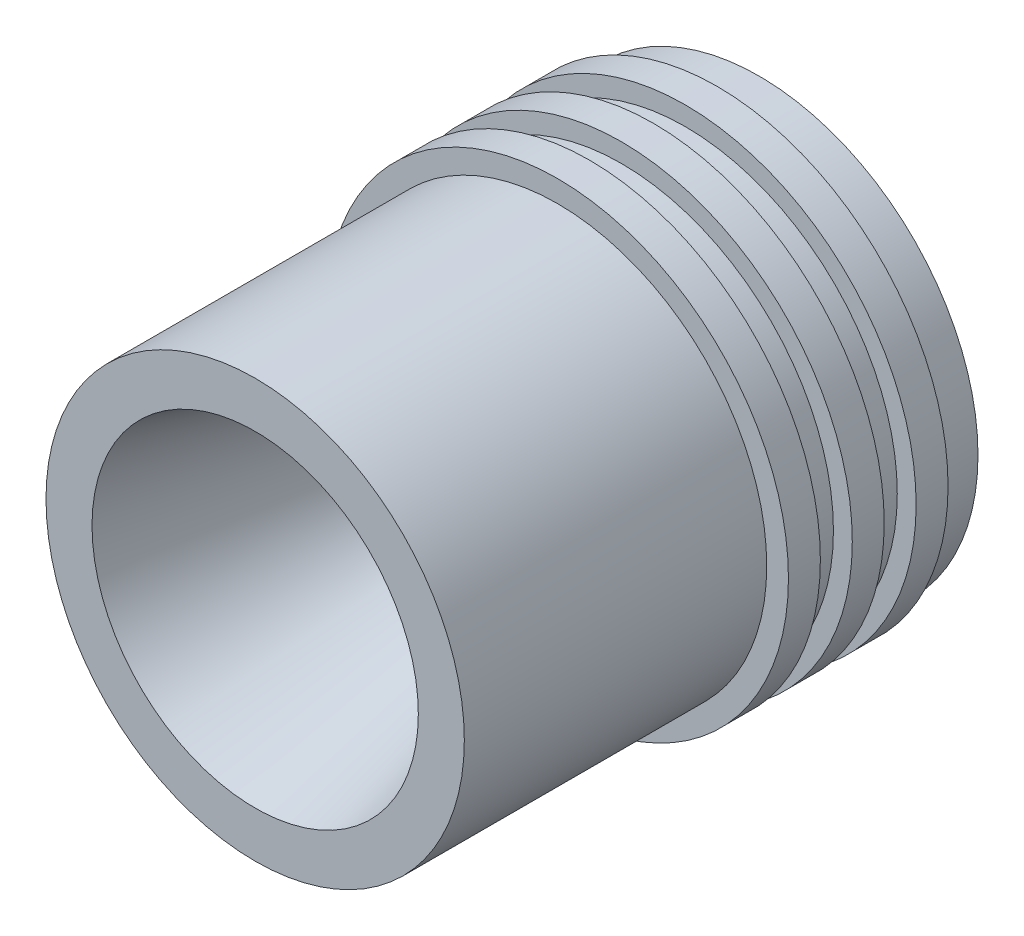
from build123d import *

# Parameters (mm, degrees)
SKETCH2_W = 6.35
SKETCH2_H = 9.652


with BuildPart() as part:
    # Sketch1 → Revolve1 (revolve)
    with BuildSketch(Plane(origin=(0, 0, 0), x_dir=(1, 0, 0), z_dir=(0, 1, 0))):
        Polygon((69.8119, 139.7), (69.8119, 91.44), (63.246, 91.44), (63.246, 0), (49.337302706, 0), (17.145, 120.143309313), (17.145, 127.763309313), (59.817, 152.4), (66.167, 152.4), (66.167, 139.7), align=None)
    revolve(axis=Axis((0, 0, 8.145225657), (0, 0, -1)))

    # Sketch2 → Cut-Revolve1 (revolve, cut)
    with BuildSketch(Plane(origin=(0, 0, 0), x_dir=(1, 0, 0), z_dir=(0, 1, 0))):
        with Locations((67.2846, 125.222)):
            Rectangle(SKETCH2_W, SKETCH2_H)
        with Locations((67.2846, 105.918)):
            Rectangle(SKETCH2_W, SKETCH2_H)
    revolve(axis=Axis((0, 0, 8.145225657), (0, 0, -1)), mode=Mode.SUBTRACT)

    # Sketch3 → Cut-Revolve2 (revolve, cut)
    with BuildSketch(Plane(origin=(0, 0, 0), x_dir=(1, 0, 0), z_dir=(0, 1, 0))):
        Polygon((50.8, 147.194032623), (50.8, 126.670279827), (40.781051615, 69.85), (30.621051615, 69.85), (17.145, 120.143309313), (17.145, 127.763309313), align=None)
    revolve(axis=Axis((0, 0, 8.145225657), (0, 0, -1)), mode=Mode.SUBTRACT)


solid = part.part
